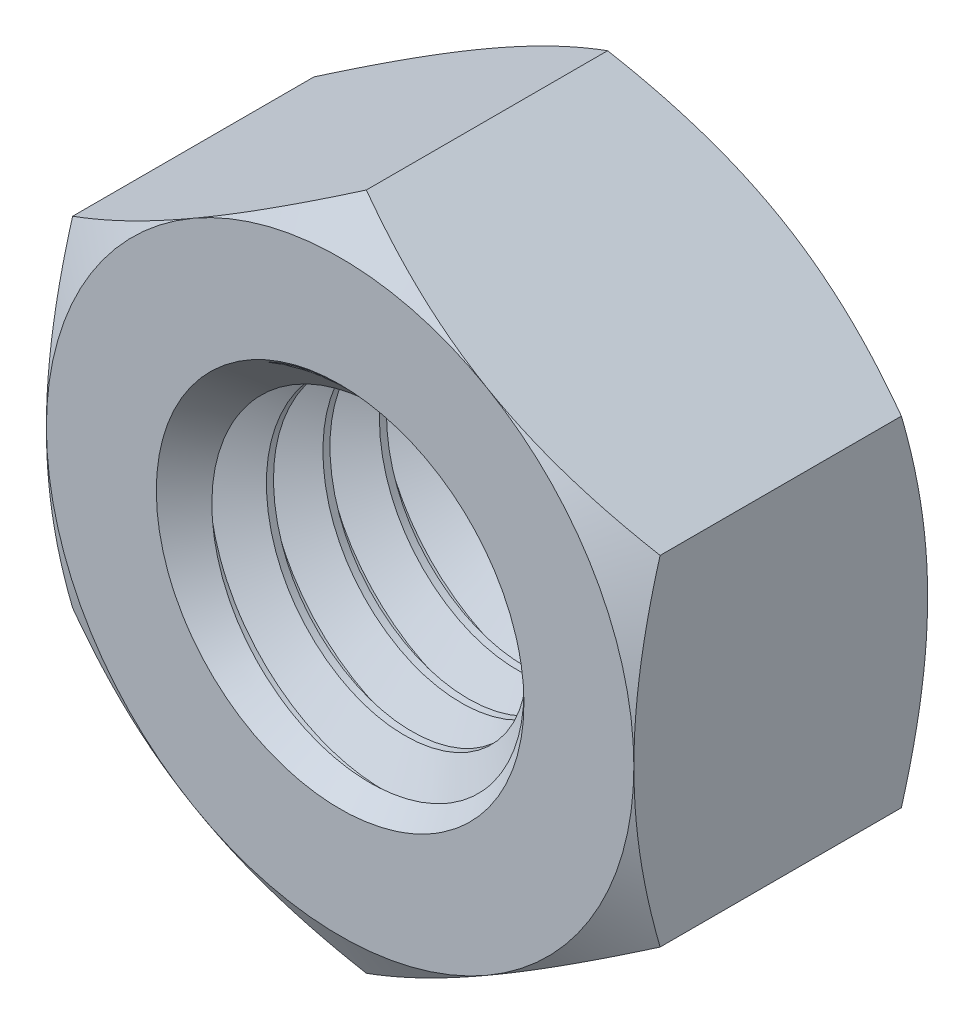
from build123d import *

# Parameters (mm, degrees)
BOSS_EXTRUDE1_DEPTH      = 3.25
BOSS_EXTRUDE1_DEPTH_BACK = 3.25
SKETCH2_R                = 4
SKETCH3_OUTSIDE_W        = 63.752
SKETCH3_OUTSIDE_H        = 65.764
SKETCH3_OUTSIDE_R        = 6.5
CUT_EXTRUDE1_DEPTH       = 12.867322079
CUT_EXTRUDE1_DRAFT       = -60
MIRROR1_COPY_1_SKETCH_W  = 63.752
MIRROR1_COPY_1_SKETCH_H  = 65.764
MIRROR1_COPY_1_SKETCH_R  = 6.5
MIRROR1_COPY_1_DEPTH     = 12.867322079
MIRROR1_COPY_1_DRAFT     = -60
SWEEP1_PITCH             = 1.25


# Read off the part's stored shape, not the designer's step: Cut-Extrude2, Cut-Extrude3
with BuildPart() as part:
    # Sketch2 → Boss-Extrude1 (new, two sides: drawn at the far end of the back side and taken through both)
    with BuildSketch(Plane.XY.offset(-BOSS_EXTRUDE1_DEPTH_BACK)):
        Polygon((0, 7.505553499), (-6.5, 3.75277675), (-6.5, -3.75277675), (0, -7.505553499), (6.5, -3.75277675), (6.5, 3.75277675), align=None)
        Circle(SKETCH2_R, mode=Mode.SUBTRACT)
    extrude(amount=BOSS_EXTRUDE1_DEPTH + BOSS_EXTRUDE1_DEPTH_BACK)


with BuildPart() as cut_extrude1_tool:
    # Sketch3 outside → Cut-Extrude1 (with draft: the straight prism first)
    with BuildSketch(Plane.XY.offset(3.25)):
        Rectangle(SKETCH3_OUTSIDE_W, SKETCH3_OUTSIDE_H)
        Circle(SKETCH3_OUTSIDE_R, mode=Mode.SUBTRACT)
    extrude(amount=-CUT_EXTRUDE1_DEPTH)
    # Cut-Extrude1: the draft: its side faces are tilted about the plane it starts from
    cut_extrude1_sides = [cut_extrude1_tool.faces().sort_by_distance(p)[0] for p in [
        (0, -32.882, -3.18366104),
        (31.876, 0, -3.18366104),
        (0, 32.882, -3.18366104),
        (-31.876, 0, -3.18366104),
        (-6.5, 0, -3.18366104),
    ]]
    draft(cut_extrude1_sides, Plane.XY.offset(3.25), CUT_EXTRUDE1_DRAFT)


with BuildPart() as part_1:
    add(part.part)

    # Cut-Extrude1: cut by cut_extrude1_tool
    add(cut_extrude1_tool.part, mode=Mode.SUBTRACT)


with BuildPart() as mirror1_copy_1_tool:
    # Mirror1 copy 1 sketch → Mirror1 copy 1 (with draft: the straight prism first)
    with BuildSketch(Plane(origin=(0, 0, -3.25), x_dir=(1, 0, 0), z_dir=(0, 0, -1))):
        Rectangle(MIRROR1_COPY_1_SKETCH_W, MIRROR1_COPY_1_SKETCH_H)
        Circle(MIRROR1_COPY_1_SKETCH_R, mode=Mode.SUBTRACT)
    extrude(amount=-MIRROR1_COPY_1_DEPTH)
    # Mirror1 copy 1: the draft: its side faces are tilted about the plane it starts from
    mirror1_copy_1_sides = [mirror1_copy_1_tool.faces().sort_by_distance(p)[0] for p in [
        (0, -32.882, 3.18366104),
        (31.876, 0, 3.18366104),
        (0, 32.882, 3.18366104),
        (-31.876, 0, 3.18366104),
        (-6.5, 0, 3.18366104),
    ]]
    draft(mirror1_copy_1_sides, Plane(origin=(0, 0, -3.25), x_dir=(1, 0, 0), z_dir=(0, 0, -1)), MIRROR1_COPY_1_DRAFT)


with BuildPart() as part_2:
    add(part_1.part)

    # Mirror1 copy 1: cut by mirror1_copy_1_tool
    add(mirror1_copy_1_tool.part, mode=Mode.SUBTRACT)

    # Sweep1: the profile of Sketch4 screwed along a right-hand helix of 6.2 turns, 8 arcs to a turn; built about Z, then put on its axis
    sweep1_z = Axis((0, 0, 0), (0, 0, 1))
    sweep1_corners = [(4.067658235, 0, -1.1328125), (3.188101184, 0, -0.625), (3.188101184, 0, -0.46875), (4.067658235, 0, 0.0390625)]
    with BuildLine(mode=Mode.PRIVATE) as sweep1_profile:
        Line(sweep1_corners[0], sweep1_corners[1])
        Line(sweep1_corners[1], sweep1_corners[2])
        Line(sweep1_corners[2], sweep1_corners[3])
        Line(sweep1_corners[3], sweep1_corners[0])
    sweep1_cap = Face(sweep1_profile.wire())
    sweep1_turn_angles = [0, 22.5, 45, 67.5, 90, 112.5, 135, 157.5, 180, 202.5, 225, 247.5, 270, 292.5, 315, 337.5, 360]
    sweep1_turn_weights = [1, 0.9238795325112867, 1, 0.9238795325112867, 1, 0.9238795325112867, 1, 0.9238795325112867, 1, 0.9238795325112867, 1, 0.9238795325112867, 1, 0.9238795325112867, 1, 0.9238795325112867, 1]
    sweep1_turn_rails = [Edge.make_bspline([Vector(p[0], p[1], 0).rotate(sweep1_z, sweep1_turn_angles[k]) / sweep1_turn_weights[k] + Vector(0, 0, p[2] + SWEEP1_PITCH * sweep1_turn_angles[k] / 360) for k in range(17)], [0, 0, 0, 1, 1, 2, 2, 3, 3, 4, 4, 5, 5, 6, 6, 7, 7, 8, 8, 8], 2, sweep1_turn_weights) for p in sweep1_corners]
    sweep1_turn_sides = [Face.make_surface_from_curves(sweep1_turn_rails[p[0]], sweep1_turn_rails[p[1]]) for p in [(0, 1), (1, 2), (2, 3), (3, 0)]]
    sweep1_last_angles = [2160, 2182.5, 2205, 2218.5, 2232]
    sweep1_last_weights = [1, 0.9238795325112867, 1, 0.9723699203976673, 1]
    sweep1_last_rails = [Edge.make_bspline([Vector(p[0], p[1], 0).rotate(sweep1_z, sweep1_last_angles[k]) / sweep1_last_weights[k] + Vector(0, 0, p[2] + SWEEP1_PITCH * sweep1_last_angles[k] / 360) for k in range(5)], [0, 0, 0, 1, 1, 2, 2, 2], 2, sweep1_last_weights) for p in sweep1_corners]
    sweep1_last_sides = [Face.make_surface_from_curves(sweep1_last_rails[p[0]], sweep1_last_rails[p[1]]) for p in [(0, 1), (1, 2), (2, 3), (3, 0)]]
    sweep1 = Plane(origin=(0, 0, 3.25), x_dir=(0, 1, 0), z_dir=(0, 0, -1)) * Solid(Shell([*[p.moved(Location((0, 0, SWEEP1_PITCH * i))) for i in range(6) for p in sweep1_turn_sides], *sweep1_last_sides, sweep1_cap, sweep1_cap.rotate(sweep1_z, 2232).moved(Location((0, 0, SWEEP1_PITCH * 2232 / 360)))]))
    add(sweep1)

    # Cut-Extrude2 outline → Cut-Extrude2 (revolve, cut)
    with BuildSketch(Plane.XZ):
        Polygon((3.188099945, 2.37044171), (4.067662141, 3.250003907), (4.067662141, 4.3828126), (3.188099945, 4.3828126), align=None)
    revolve(axis=Axis((0, 0, 0), (0, 0, 1)), mode=Mode.SUBTRACT)

    # Cut-Extrude3 outline → Cut-Extrude3 (revolve, cut)
    with BuildSketch(Plane.XZ):
        Polygon((4.067659639, -3.250001404), (3.188099945, -2.37044171), (3.188099945, -4.539454264), (4.067659639, -4.539454264), align=None)
    revolve(axis=Axis((0, 0, 0), (0, 0, 1)), mode=Mode.SUBTRACT)


solid = part_2.part
